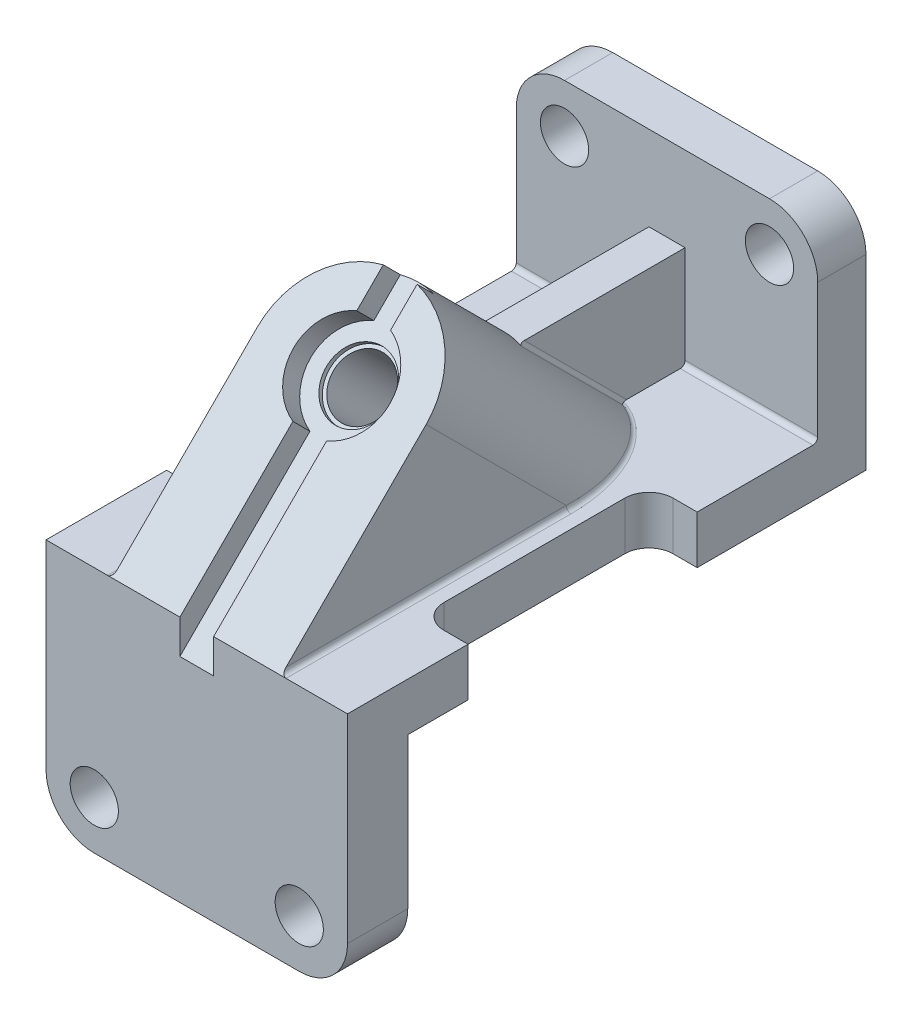
from build123d import *

# Parameters (mm, degrees)
SKETCH1_W            = 125
SKETCH1_H            = 102.5
BOSS_EXTRUDE1_DEPTH  = 12.5
SKETCH2_W            = 215
SKETCH2_H            = 20
BOSS_EXTRUDE2_DEPTH  = 125
SKETCH3_W            = 125
SKETCH3_H            = 97.5
BOSS_EXTRUDE3_DEPTH  = 20
BOSS_EXTRUDE4_REACH  = 263.195
SKETCH13_R           = 20
CUT_EXTRUDE1_DEPTH   = 10
RIB1_START           = -7.5
RIB1_OUTLINE_W       = 70.5
RIB1_OUTLINE_H       = 42.426406871
RIB1_DEPTH           = 15
FILLET1_R            = 20
HOLE1_START          = -12.5
HOLE1_OUTLINE_R      = 10
HOLE1_DEPTH          = 25
LPATTERN1_COUNT      = 2
LPATTERN1_PITCH      = 85
SKETCH18_R           = 10
CUT_EXTRUDE3_DEPTH   = 20
CUT_EXTRUDE5_DEPTH   = 10
SKETCH21_R           = 12
CUT_EXTRUDE6_DEPTH   = 100
SKETCH22_R           = 13.5
CUT_EXTRUDE7_DEPTH   = 2
SKETCH25_W           = 20
SKETCH25_H           = 95
CUT_EXTRUDE9_DEPTH   = 46
FILLET2_R            = 10
FILLET2_OF_MIRROR2_R = 10
FILLET3_R            = 2


# Read off the part's stored shape, not the designer's step: Rib1, Hole1
with BuildPart() as part:
    # Sketch1 → Boss-Extrude1 (new, symmetric)
    with BuildSketch(Plane.XY):
        Rectangle(SKETCH1_W, SKETCH1_H)
    extrude(amount=BOSS_EXTRUDE1_DEPTH, both=True)

    # Sketch2 → Boss-Extrude2 (add)
    with BuildSketch(Plane(origin=(62.5, 0, 0), x_dir=(0, 0, -1), z_dir=(1, 0, 0))):
        with Locations((95, 41.25)):
            Rectangle(SKETCH2_W, SKETCH2_H)
    extrude(amount=-BOSS_EXTRUDE2_DEPTH)

    # Sketch3 → Boss-Extrude3 (add)
    with BuildSketch(Plane(origin=(0, 0, -202.5), x_dir=(-1, 0, 0), z_dir=(0, 0, -1))):
        with Locations((0, 80)):
            Rectangle(SKETCH3_W, SKETCH3_H)
    extrude(amount=-BOSS_EXTRUDE3_DEPTH)

    # Sketch11 → Boss-Extrude4 (add, up to next)
    with BuildSketch(Plane(origin=(0, 31.875, 31.875), x_dir=(0, 0.7071067811865489, -0.7071067811865462), z_dir=(0, -0.7071067811865462, -0.7071067811865489)), mode=Mode.PRIVATE) as boss_extrude4_sk1:
        with BuildLine():
            Line((27.400387771, -35), (112.400387771, -35))
            ThreePointArc((112.400387771, -35), (147.400387771, 0), (112.400387771, 35))
            Line((112.400387771, 35), (27.400387771, 35))
            Line((27.400387771, 35), (27.400387771, -35))
        make_face()
    boss_extrude4_tool1 = extrude(boss_extrude4_sk1.sketch, amount=BOSS_EXTRUDE4_REACH, mode=Mode.PRIVATE) - part.part
    add(boss_extrude4_tool1.solids().sort_by_distance((0, 91.212647, -27.462647))[0])

    # Sketch13 → Cut-Extrude1 (cut)
    with BuildSketch(Plane(origin=(0, 31.875, 31.875), x_dir=(1, 0, 0), z_dir=(0, 0.7071067811865465, 0.7071067811865487))):
        with Locations(Location((0, 112.400387771, 0), (0, 0, 270))):
            Circle(SKETCH13_R)
    extrude(amount=-CUT_EXTRUDE1_DEPTH, mode=Mode.SUBTRACT)

    # Rib1 outline → Rib1 (add)
    with BuildSketch(Plane(origin=(0, 0, 0), x_dir=(0, 0, -1), z_dir=(1, 0, 0)).offset(RIB1_START)):
        with Locations((147.25, 72.463203436)):
            Rectangle(RIB1_OUTLINE_W, RIB1_OUTLINE_H)
    extrude(amount=RIB1_DEPTH)

    # Fillet1
    fillet1_edges = [part.edges().sort_by_distance(p)[0] for p in [
        (-62.5, 128.75, -192.5),
        (62.5, 128.75, -192.5),
        (62.5, -51.25, 0),
        (-62.5, -51.25, 0),
    ]]
    fillet(fillet1_edges, radius=FILLET1_R)

    # Hole1 outline → Hole1 (cut)
    with BuildSketch(Plane.XY.offset(HOLE1_START)):
        with Locations((-42.5, -31.25)):
            Circle(HOLE1_OUTLINE_R)
    hole1 = extrude(amount=HOLE1_DEPTH, mode=Mode.SUBTRACT)

    # LPattern1: Hole1 ×2
    with Locations(*[(i * LPATTERN1_PITCH, 0, 0) for i in range(1, LPATTERN1_COUNT)]):
        add(hole1, mode=Mode.SUBTRACT)

    # Sketch18 → Cut-Extrude3 (cut)
    with BuildSketch(Plane.XY.offset(-182.5)):
        with Locations((-42.5, 108.75)):
            Circle(SKETCH18_R)
    cut_extrude3 = extrude(amount=-CUT_EXTRUDE3_DEPTH, mode=Mode.SUBTRACT)

    # Mirror1: Cut-Extrude3 across plane
    add(cut_extrude3.mirror(Plane(origin=(0, 0, 0), x_dir=(0, 0, 1), z_dir=(1, 0, 0))), mode=Mode.SUBTRACT)

    # Sketch19 → Cut-Extrude5 (cut)
    with BuildSketch(Plane(origin=(0, 31.875, 31.875), x_dir=(1, 0, 0), z_dir=(0, 0.7071067811865465, 0.7071067811865487))):
        with BuildLine():
            Line((-7, 146.69324417), (-7, 27.400387771))
            Line((-7, 27.400387771), (-7, 12.400387771))
            Line((-7, 12.400387771), (7, 12.400387771))
            Line((7, 12.400387771), (7, 27.400387771))
            Line((7, 27.400387771), (7, 146.69324417))
            ThreePointArc((7, 146.69324417), (0, 147.400387771), (-7, 146.69324417))
        make_face()
    extrude(amount=-CUT_EXTRUDE5_DEPTH, mode=Mode.SUBTRACT)

    # Sketch21 → Cut-Extrude6 (cut)
    with BuildSketch(Plane(origin=(0, 31.875, 31.875), x_dir=(1, 0, 0), z_dir=(0, 0.7071067811865465, 0.7071067811865487))):
        with Locations(Location((0, 112.400387771, 0), (0, 0, 270))):
            Circle(SKETCH21_R)
    extrude(amount=-CUT_EXTRUDE6_DEPTH, mode=Mode.SUBTRACT)

    # Sketch22 → Cut-Extrude7 (cut)
    with BuildSketch(Plane(origin=(0, 24.803932188, 24.803932188), x_dir=(1, 0, 0), z_dir=(0, 0.7071067811865465, 0.7071067811865486))):
        with Locations(Location((0, 112.400387771, 0), (0, 0, 270))):
            Circle(SKETCH22_R)
    extrude(amount=-CUT_EXTRUDE7_DEPTH, mode=Mode.SUBTRACT)

    # Sketch25 → Cut-Extrude9 (cut)
    with BuildSketch(Plane(origin=(0, 51.25, 0), x_dir=(1, 0, 0), z_dir=(0, 1, 0))):
        with Locations((52.5, 85)):
            Rectangle(SKETCH25_W, SKETCH25_H)
    cut_extrude9 = extrude(amount=-CUT_EXTRUDE9_DEPTH, mode=Mode.SUBTRACT)

    # Fillet2
    fillet2_edges = [part.edges().sort_by_distance(p)[0] for p in [
        (42.5, 41.25, -37.5),
        (42.5, 41.25, -132.5),
    ]]
    fillet(fillet2_edges, radius=FILLET2_R)

    # Mirror2: Cut-Extrude9 across plane
    add(cut_extrude9.mirror(Plane(origin=(0, 0, 0), x_dir=(0, 0, 1), z_dir=(1, 0, 0))), mode=Mode.SUBTRACT)

    # Fillet2 of Mirror2
    fillet2_of_mirror2_edges = [part.edges().sort_by_distance(p)[0] for p in [
        (-42.5, 41.25, -37.5),
        (-42.5, 41.25, -132.5),
    ]]
    fillet(fillet2_of_mirror2_edges, radius=FILLET2_OF_MIRROR2_R)

    # Fillet3
    fillet3_edges = [part.edges().sort_by_distance(p)[0] for p in [
        (-35, 51.25, -182.5),
        (-35, 51.25, -47.604076401),
        (-28.546235704, 51.25, -136.347720786),
        (35, 51.25, -47.604076401),
        (28.546235704, 51.25, -136.347720786),
        (35, 51.25, -182.5),
        (-7.5, 72.463203435, -134.842648381),
        (7.5, 72.463203435, -134.842648381),
    ]]
    fillet(fillet3_edges, radius=FILLET3_R)


solid = part.part
